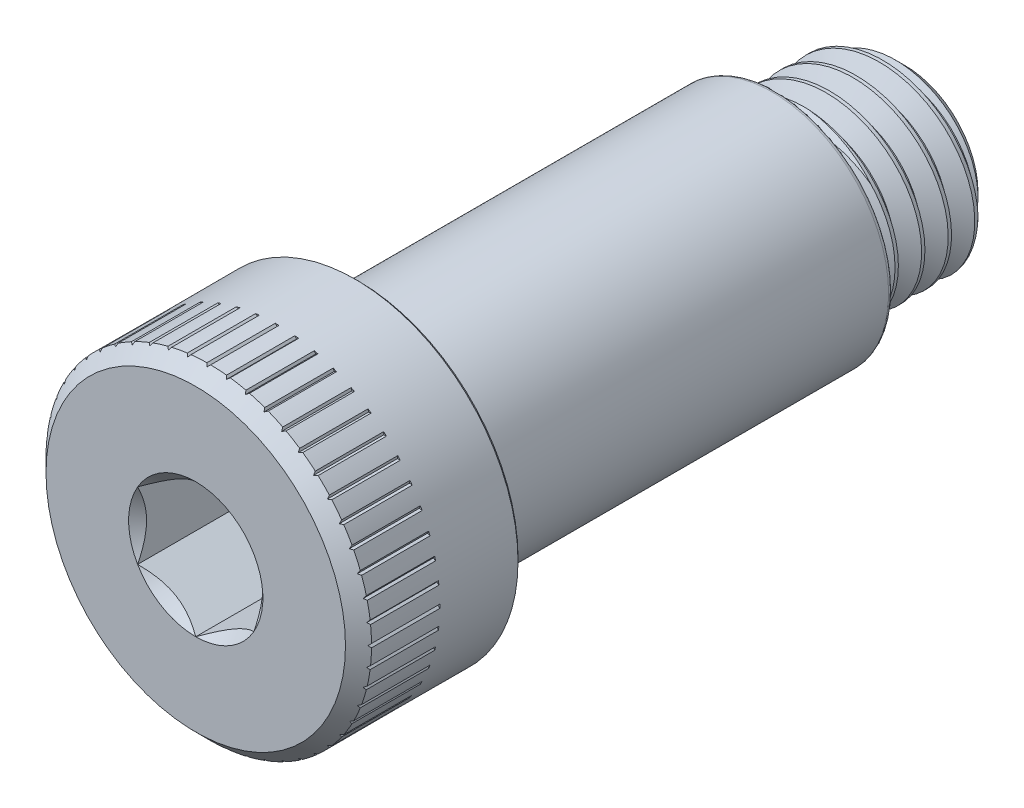
from build123d import *

# Parameters (mm, degrees)
CUT_EXTRUDE1_DEPTH = 3.33375
FILLET1_R          = 0.333375
CHAMFER1_SIZE      = 0.4445
CHAMFER2_SIZE      = 0.680357143
CHAMFER3_SIZE      = 0.111125
FILLET2_R          = 0.555625
FILLET3_R          = 0.15875
CUT_SWEEP1_PITCH   = 0.907142857
CUT_EXTRUDE5_DEPTH = 2.778125
CIRPATTERN1_COUNT  = 52


# Read off the part's stored shape, not the designer's step: Boss-Extrude1
with BuildPart() as part:
    # Sketch2 → Revolve1 (revolve)
    with BuildSketch(Plane(origin=(0, 0, 0), x_dir=(0, 0, -1), z_dir=(1, 0, 0)), mode=Mode.PRIVATE) as revolve1_sk:
        Polygon((24.209375, 3.175), (24.209375, 0), (0, 0), (0, 5.55625), (5.55625, 5.55625), (5.55625, 3.96875), (19.84375, 3.96875), (19.84375, 2.854276567), (20.274642857, 2.854276567), (20.59536629, 3.175), align=None)
    revolve(revolve1_sk.sketch.rotate(Axis((0, 0, 0), (0, 0, -1)), 90), axis=Axis((0, 0, 0), (0, 0, -1)))

    # Sketch3 → Cut-Extrude1 (cut)
    with BuildSketch(Plane.XY):
        Polygon((1.984375, 1.14567944), (0, 2.291358881), (-1.984375, 1.14567944), (-1.984375, -1.14567944), (0, -2.291358881), (1.984375, -1.14567944), align=None)
    extrude(amount=-CUT_EXTRUDE1_DEPTH, mode=Mode.SUBTRACT)

    # Cut-Extrude4 cone 1 section (through the dimple's axis) → Cut-Extrude4 (revolve, cut)
    with BuildSketch(Plane(origin=(0, 0, 0), x_dir=(0, -1, 0), z_dir=(1, 0, 0))):
        Polygon((0, 0), (2.291358881, 0), (0, 2.291358881), align=None)
    revolve(axis=Axis((0, 0, 0), (0, 0, -1)), mode=Mode.SUBTRACT)

    # Fillet1
    fillet1_edges = [part.edges().sort_by_distance(p)[0] for p in [
        (-3.96875, 0, -5.55625),
    ]]
    fillet(fillet1_edges, radius=FILLET1_R)

    # Chamfer1
    chamfer1_edges = [part.edges().sort_by_distance(p)[0] for p in [
        (-5.55625, 0, 0),
    ]]
    chamfer(chamfer1_edges, length=CHAMFER1_SIZE)

    # Chamfer2
    chamfer2_edges = [part.edges().sort_by_distance(p)[0] for p in [
        (-3.175, 0, -24.209375),
    ]]
    chamfer(chamfer2_edges, length=CHAMFER2_SIZE)

    # Chamfer3
    chamfer3_edges = [part.edges().sort_by_distance(p)[0] for p in [
        (-5.55625, 0, -5.55625),
    ]]
    chamfer(chamfer3_edges, length=CHAMFER3_SIZE)

    # Fillet2
    # the kernel refuses this fillet: 0.555625 mm, written as the material it adds along each edge
    with BuildSketch(Plane(origin=(0, 0, -19.84375), x_dir=(1, 0, 0), z_dir=(0, 1, 0))) as fillet2_piece_1:
        with BuildLine():
            CenterArc((3.395720039, 0.555625), FILLET2_R, 192.972878151, 77.027121849)
            Line((2.854276567, 0.430892857), (2.843447698, 0.428398214))
            ThreePointArc((2.843447698, 0.428398214), (2.843164067, 0.215446429), (2.843164067, 0))
            Line((2.843164067, 0), (2.854276567, -0.0111125))
            Line((2.854276567, -0.0111125), (3.395720039, -0.0111125))
            Line((3.395720039, -0.0111125), (3.395720039, 0))
        make_face()
    revolve(axis=Axis((0, 0, -19.84375), (0, 0, -1)))

    # Fillet3
    fillet3_edges = [part.edges().sort_by_distance(p)[0] for p in [
        (-3.96875, 0, -19.84375),
    ]]
    fillet(fillet3_edges, radius=FILLET3_R)


with BuildPart() as body_2:
    # Split1: the piece on the far side of the plane
    add(part.part)
    split(bisect_by=Plane.XY.offset(-20.274642857), keep=Keep.BOTTOM)

    # Cut-Sweep1: the profile of Sketch6 profile screwed along a right-hand helix of 5.8125 turns, 8 arcs to a turn; built about Z, then put on its axis
    cut_sweep1_z = Axis((0, 0, 0), (0, 0, 1))
    cut_sweep1_corners = [(3.1753, 0, 0.000173205), (3.1753, 0, -0.793923205), (2.585793431, 0, -0.453571429), (2.585793431, 0, -0.340178571)]
    with BuildLine(mode=Mode.PRIVATE) as cut_sweep1_profile:
        Line(cut_sweep1_corners[0], cut_sweep1_corners[1])
        Line(cut_sweep1_corners[1], cut_sweep1_corners[2])
        Line(cut_sweep1_corners[2], cut_sweep1_corners[3])
        Line(cut_sweep1_corners[3], cut_sweep1_corners[0])
    cut_sweep1_cap = Face(cut_sweep1_profile.wire())
    cut_sweep1_turn_angles = [0, 22.5, 45, 67.5, 90, 112.5, 135, 157.5, 180, 202.5, 225, 247.5, 270, 292.5, 315, 337.5, 360]
    cut_sweep1_turn_weights = [1, 0.9238795325112867, 1, 0.9238795325112867, 1, 0.9238795325112867, 1, 0.9238795325112867, 1, 0.9238795325112867, 1, 0.9238795325112867, 1, 0.9238795325112867, 1, 0.9238795325112867, 1]
    cut_sweep1_turn_rails = [Edge.make_bspline([Vector(p[0], p[1], 0).rotate(cut_sweep1_z, cut_sweep1_turn_angles[k]) / cut_sweep1_turn_weights[k] + Vector(0, 0, p[2] + CUT_SWEEP1_PITCH * cut_sweep1_turn_angles[k] / 360) for k in range(17)], [0, 0, 0, 1, 1, 2, 2, 3, 3, 4, 4, 5, 5, 6, 6, 7, 7, 8, 8, 8], 2, cut_sweep1_turn_weights) for p in cut_sweep1_corners]
    cut_sweep1_turn_sides = [Face.make_surface_from_curves(cut_sweep1_turn_rails[p[0]], cut_sweep1_turn_rails[p[1]]) for p in [(0, 1), (1, 2), (2, 3), (3, 0)]]
    cut_sweep1_turn = Solid(Shell([*cut_sweep1_turn_sides, cut_sweep1_cap, cut_sweep1_cap.rotate(cut_sweep1_z, 360).moved(Location((0, 0, CUT_SWEEP1_PITCH * 360 / 360)))]))
    cut_sweep1_last_angles = [1800, 1822.5, 1845, 1867.5, 1890, 1912.5, 1935, 1957.5, 1980, 2002.5, 2025, 2047.5, 2070, 2081.25, 2092.5]
    cut_sweep1_last_weights = [1, 0.9238795325112867, 1, 0.9238795325112867, 1, 0.9238795325112867, 1, 0.9238795325112867, 1, 0.9238795325112867, 1, 0.9238795325112867, 1, 0.9807852804032475, 1]
    cut_sweep1_last_rails = [Edge.make_bspline([Vector(p[0], p[1], 0).rotate(cut_sweep1_z, cut_sweep1_last_angles[k]) / cut_sweep1_last_weights[k] + Vector(0, 0, p[2] + CUT_SWEEP1_PITCH * cut_sweep1_last_angles[k] / 360) for k in range(15)], [0, 0, 0, 1, 1, 2, 2, 3, 3, 4, 4, 5, 5, 6, 6, 7, 7, 7], 2, cut_sweep1_last_weights) for p in cut_sweep1_corners]
    cut_sweep1_last_sides = [Face.make_surface_from_curves(cut_sweep1_last_rails[p[0]], cut_sweep1_last_rails[p[1]]) for p in [(0, 1), (1, 2), (2, 3), (3, 0)]]
    cut_sweep1_last = Solid(Shell([*cut_sweep1_last_sides, cut_sweep1_cap.rotate(cut_sweep1_z, 1800).moved(Location((0, 0, CUT_SWEEP1_PITCH * 1800 / 360))), cut_sweep1_cap.rotate(cut_sweep1_z, 2092.5).moved(Location((0, 0, CUT_SWEEP1_PITCH * 2092.5 / 360)))]))
    cut_sweep1_each = [*[cut_sweep1_turn.moved(Location((0, 0, CUT_SWEEP1_PITCH * i))) for i in range(5)], cut_sweep1_last]
    add(Plane(origin=(0, 0, -24.209375), x_dir=(0, 1, 0), z_dir=(0, 0, 1)) * Compound([cut_sweep1_each[i] for i in range(0, 6, 2)]), mode=Mode.SUBTRACT)
    add(Plane(origin=(0, 0, -24.209375), x_dir=(0, 1, 0), z_dir=(0, 0, 1)) * Compound([cut_sweep1_each[i] for i in range(1, 6, 2)]), mode=Mode.SUBTRACT)

    # Boss-Extrude1 outline → Boss-Extrude1 (revolve)
    with BuildSketch(Plane.XZ):
        Polygon((2.585788069, -20.274642857), (2.585788069, -20.543131356), (2.854276567, -20.274642857), align=None)
    revolve(axis=Axis((0, 0, 0), (0, 0, 1)))


with BuildPart() as part_1:
    add(part.part)

    # Split1
    split(bisect_by=Plane.XY.offset(-20.274642857), keep=Keep.TOP)

    # Combine1: union body 2
    add(body_2.part)

    # Sketch8 → Cut-Extrude5 (cut)
    with BuildSketch(Plane.XY):
        Polygon((-0.066675, 5.55879), (0, 5.492115), (0.066675, 5.55879), align=None)
    cut_extrude5 = extrude(amount=-CUT_EXTRUDE5_DEPTH, mode=Mode.SUBTRACT)

    # CirPattern1: Cut-Extrude5 ×52 about axis
    cirpattern1_axis = Axis((0, 0, 0), (0, 0, 1))
    for i in range(1, CIRPATTERN1_COUNT):
        add(cut_extrude5.rotate(cirpattern1_axis, i * 360 / CIRPATTERN1_COUNT), mode=Mode.SUBTRACT)


solid = part_1.part
